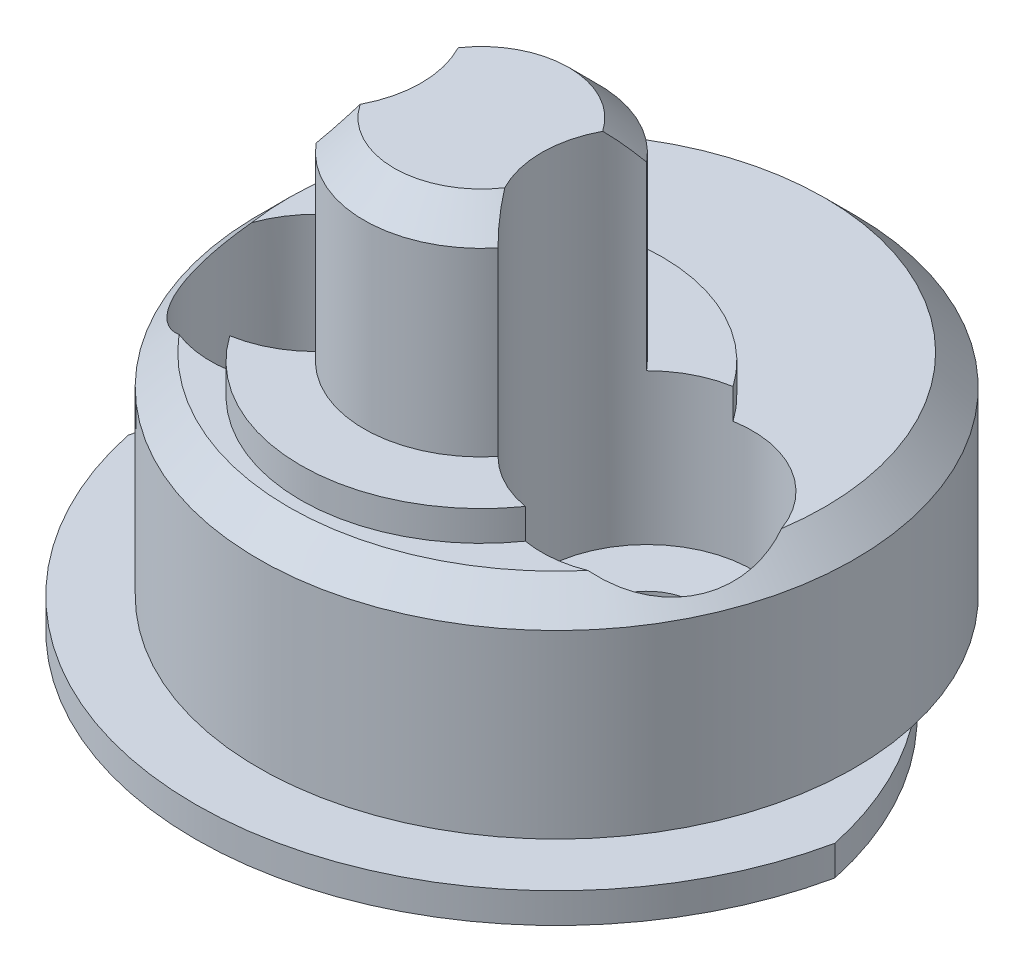
from build123d import *

# Parameters (mm, degrees)
SKETCH1_R               = 3.9
BOSS_EXTRUDE1_DEPTH     = 7
SKETCH2_R               = 6
BOSS_EXTRUDE2_DEPTH     = 1
SKETCH3_R               = 9.9
BOSS_EXTRUDE3_DEPTH     = 7
BOSS_EXTRUDE4_DEPTH     = 1
SKETCH5_R               = 1.6
CUT_EXTRUDE1_DEPTH      = 20.300518128
CUT_EXTRUDE2_DEPTH      = 20.300518128
CUT_EXTRUDE2_DEPTH_BACK = 5
SKETCH7_R               = 3.5
CHAMFER1_SIZE           = 1


with BuildPart() as part:
    # Sketch1 → Boss-Extrude1 (new body)
    with BuildSketch(Plane(origin=(0, 0, 0), x_dir=(1, 0, 0), z_dir=(0, 1, 0))):
        with Locations(Location((0, 0, 0), (0, 0, 270))):
            Circle(SKETCH1_R)
    extrude(amount=BOSS_EXTRUDE1_DEPTH)

    # Sketch2 → Boss-Extrude2 (add)
    with BuildSketch(Plane(origin=(0, 0, 0), x_dir=(-1, 0, 0), z_dir=(0, -1, 0))):
        with Locations(Location((0, 0, 0), (0, 0, 90))):
            Circle(SKETCH2_R)
    extrude(amount=BOSS_EXTRUDE2_DEPTH)

    # Sketch3 → Boss-Extrude3 (add)
    with BuildSketch(Plane(origin=(0, -1, 0), x_dir=(-1, 0, 0), z_dir=(0, -1, 0))):
        with Locations(Location((0, 2.5, 0), (0, 0, 90))):
            Circle(SKETCH3_R)
    extrude(amount=BOSS_EXTRUDE3_DEPTH)

    # Sketch4 → Boss-Extrude4 (add)
    with BuildSketch(Plane(origin=(0, -8, 0), x_dir=(-1, 0, 0), z_dir=(0, -1, 0))):
        with BuildLine():
            ThreePointArc((-11.736694594, 0), (0, -9.5), (11.736694594, 0))
            ThreePointArc((11.736694594, 0), (0, 9.5), (-11.736694594, 0))
        make_face()
    extrude(amount=BOSS_EXTRUDE4_DEPTH)

    # Sketch5 → Cut-Extrude1 (cut, through all)
    with BuildSketch(Plane(origin=(0, 0, 0), x_dir=(1, 0, 0), z_dir=(0, 1, 0))):
        with Locations(Location((5.5, 0, 0), (0, 0, 270))):
            Circle(SKETCH5_R)
        with Locations(Location((-5.5, 0, 0), (0, 0, 270))):
            Circle(SKETCH5_R)
    extrude(amount=-CUT_EXTRUDE1_DEPTH, mode=Mode.SUBTRACT)

    # Sketch7 → Cut-Extrude2 (cut, two sides: drawn at the far end of the back side and taken through both)
    with BuildSketch(Plane(origin=(0, 0, 0), x_dir=(1, 0, 0), z_dir=(0, 1, 0)).offset(-CUT_EXTRUDE2_DEPTH_BACK)):
        with Locations(Location((-5.5, 0, 0), (0, 0, 80.280132298))):
            Circle(SKETCH7_R)
        with Locations(Location((5.5, 0, 0), (0, 0, 99.719867702))):
            Circle(SKETCH7_R)
    extrude(amount=CUT_EXTRUDE2_DEPTH + CUT_EXTRUDE2_DEPTH_BACK, mode=Mode.SUBTRACT)

    # Chamfer1
    # the kernel refuses this chamfer: 1 mm, written as the material it takes off along each edge
    with BuildSketch(Plane(origin=(0, -1, -2.5), x_dir=(0, 0, -1), z_dir=(-1, 0, 0))) as chamfer1_piece_1:
        Polygon((9.9, CHAMFER1_SIZE), (9.9 - CHAMFER1_SIZE, 0), (9.9, 0), align=None)
    revolve(axis=Axis((0, -1, -2.5), (0, -1, 0)), mode=Mode.SUBTRACT)
    with BuildSketch(Plane(origin=(0, 7, 0), x_dir=(0.9996692397523004, 0, -0.025717913855091756), z_dir=(0.025717913855091756, 0, 0.9996692397523004))) as chamfer1_piece_2:
        Polygon((3.9 - CHAMFER1_SIZE, 0), (3.9, -CHAMFER1_SIZE), (3.9, 0), align=None)
    revolve(axis=Axis((0, 7, 0), (0, 1, 0)), revolution_arc=177.05261919, mode=Mode.SUBTRACT)
    with BuildSketch(Plane(origin=(0, 7, 0), x_dir=(0.9996692397523004, 0, 0.02571791385509249), z_dir=(0.02571791385509249, 0, -0.9996692397523004))) as chamfer1_piece_3:
        Polygon((3.9, CHAMFER1_SIZE), (3.9 - CHAMFER1_SIZE, 0), (3.9, 0), align=None)
    revolve(axis=Axis((0, 7, 0), (0, -1, 0)), revolution_arc=177.05261919, mode=Mode.SUBTRACT)


solid = part.part
